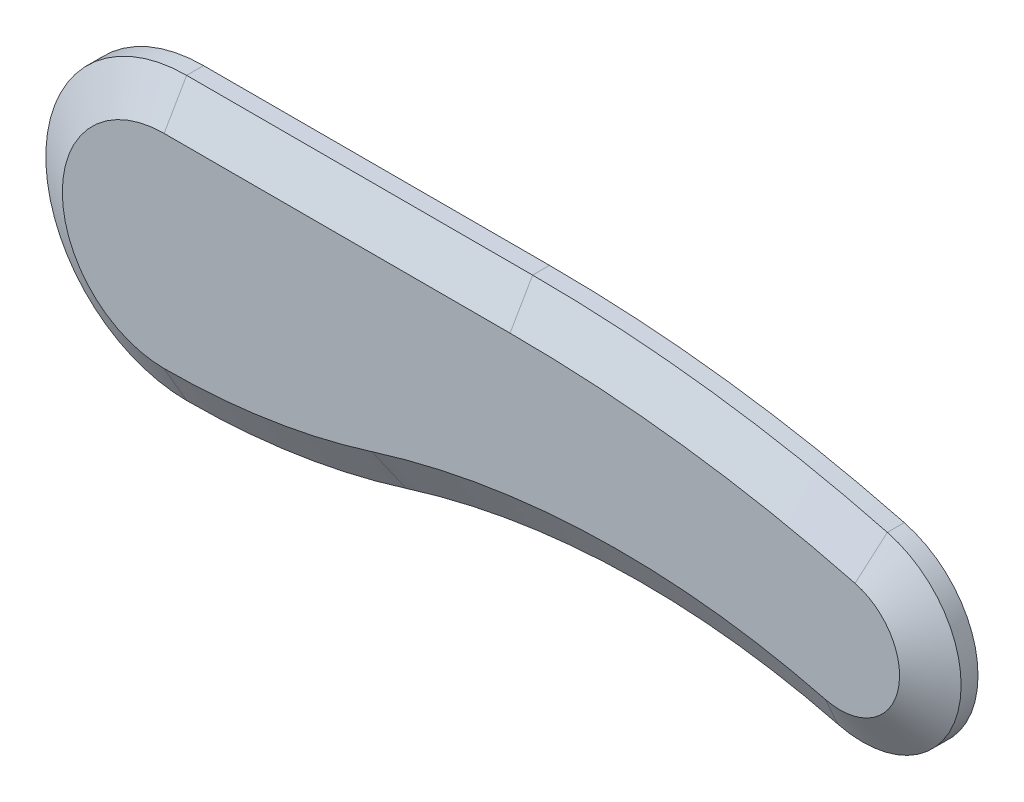
from build123d import *
from OCP.BRepFilletAPI import BRepFilletAPI_MakeChamfer

# Parameters (mm, degrees)
BOSS_EXTRUDE1_DEPTH = 7
CHAMFER1_SIZE       = 4
CHAMFER1_SIZE2      = 6.92820323
SKETCH3_R           = 8.5
CUT_EXTRUDE2_DEPTH  = 4
CUT_EXTRUDE3_DEPTH  = 3.5
SKETCH5_3_R         = 2.125
CUT_EXTRUDE4_DEPTH  = 140.826678427
CHAMFER2_SIZE       = 0.5
CHAMFER2_SIZE2      = 1.37373871
BOSS_EXTRUDE2_START = 0.5
SKETCH7_R           = 9.5
SKETCH7_R_2         = 8.5
BOSS_EXTRUDE2_DEPTH = 0.5


with BuildPart() as part:
    # Sketch1 → Boss-Extrude1 (new body)
    with BuildSketch(Plane.XY):
        with BuildLine():
            Line((61.423127431, 25), (0, 25))
            ThreePointArc((0, 25), (-25, 0), (0, -25))
            ThreePointArc((0, -25), (19.714733683, -23.496417366), (38.973425347, -19.020450397))
            ThreePointArc((38.973425347, -19.020450397), (77.172636951, -12.631763464), (115.660534054, -16.953437271))
            ThreePointArc((115.660534054, -16.953437271), (136.944496251, -4.374248141), (124.409011914, 16.935483871))
            ThreePointArc((124.409011914, 16.935483871), (93.173159181, 22.975675186), (61.423127431, 25))
        make_face()
    extrude(amount=BOSS_EXTRUDE1_DEPTH)

    # Chamfer1: one chamfer whose edges measure the first distance from different faces: ONE call of the kernel's chamfer builder (chamfer() names one face for all edges)
    chamfer1_edges_1 = [part.edges().sort_by_distance(p)[0] for p in [
        (19.714733683, -23.496417366, 7),
    ]]
    chamfer1_side_1 = [part.faces().sort_by_distance(p)[0] for p in [
        (19.714733683, -23.496417366, 3.5),
    ]]
    chamfer1_edges_2 = [part.edges().sort_by_distance(p)[0] for p in [
        (-25, 0, 7),
    ]]
    chamfer1_side_2 = [part.faces().sort_by_distance(p)[0] for p in [
        (-25, 0, 3.5),
    ]]
    chamfer1_edges_3 = [part.edges().sort_by_distance(p)[0] for p in [
        (30.711563715, 25, 7),
    ]]
    chamfer1_side_3 = [part.faces().sort_by_distance(p)[0] for p in [
        (30.711563715, 25, 3.5),
    ]]
    chamfer1_edges_4 = [part.edges().sort_by_distance(p)[0] for p in [
        (93.173159181, 22.975675186, 7),
    ]]
    chamfer1_side_4 = [part.faces().sort_by_distance(p)[0] for p in [
        (93.173159181, 22.975675186, 3.5),
    ]]
    chamfer1_edges_5 = [part.edges().sort_by_distance(p)[0] for p in [
        (136.944496251, -4.374248141, 7),
    ]]
    chamfer1_side_5 = [part.faces().sort_by_distance(p)[0] for p in [
        (136.944496251, -4.374248141, 3.5),
    ]]
    chamfer1_edges_6 = [part.edges().sort_by_distance(p)[0] for p in [
        (77.172636951, -12.631763464, 7),
    ]]
    chamfer1_side_6 = [part.faces().sort_by_distance(p)[0] for p in [
        (77.172636951, -12.631763464, 3.5),
    ]]
    chamfer1 = BRepFilletAPI_MakeChamfer(part.part.solid().wrapped)
    for e in chamfer1_edges_1:
        chamfer1.Add(CHAMFER1_SIZE, CHAMFER1_SIZE2, e.wrapped, chamfer1_side_1[0].wrapped)  # the first distance lies on this face
    for e in chamfer1_edges_2:
        chamfer1.Add(CHAMFER1_SIZE, CHAMFER1_SIZE2, e.wrapped, chamfer1_side_2[0].wrapped)  # the first distance lies on this face
    for e in chamfer1_edges_3:
        chamfer1.Add(CHAMFER1_SIZE, CHAMFER1_SIZE2, e.wrapped, chamfer1_side_3[0].wrapped)  # the first distance lies on this face
    for e in chamfer1_edges_4:
        chamfer1.Add(CHAMFER1_SIZE, CHAMFER1_SIZE2, e.wrapped, chamfer1_side_4[0].wrapped)  # the first distance lies on this face
    for e in chamfer1_edges_5:
        chamfer1.Add(CHAMFER1_SIZE, CHAMFER1_SIZE2, e.wrapped, chamfer1_side_5[0].wrapped)  # the first distance lies on this face
    for e in chamfer1_edges_6:
        chamfer1.Add(CHAMFER1_SIZE, CHAMFER1_SIZE2, e.wrapped, chamfer1_side_6[0].wrapped)  # the first distance lies on this face
    add(Compound.cast(chamfer1.Shape()), mode=Mode.REPLACE)

    # Sketch3 → Cut-Extrude2 (cut)
    with BuildSketch(Plane(origin=(0, 0, 0), x_dir=(-1, 0, 0), z_dir=(0, 0, -1))):
        Circle(SKETCH3_R)
        with Locations((-120, 0)):
            Circle(SKETCH3_R)
    extrude(amount=-CUT_EXTRUDE2_DEPTH, mode=Mode.SUBTRACT)

    # Sketch5 → Cut-Extrude3 (cut)
    with BuildSketch(Plane(origin=(0, 0, 2.5), x_dir=(-1, 0, 0), z_dir=(0, 0, -1))):
        with BuildLine():
            Line((-86.046403676, 16.921929528), (-88.139298402, 13.296929528))
            Line((-88.139298402, 13.296929528), (-86.046403676, 9.671929528))
            Line((-86.046403676, 9.671929528), (-78.548867374, 9.671929528))
            ThreePointArc((-78.548867374, 9.671929528), (-67.767719499, 13.296929528), (-78.548867374, 16.921929528))
            Line((-78.548867374, 16.921929528), (-86.046403676, 16.921929528))
        make_face()
        with BuildLine():
            Line((-62.092894726, -3.625), (-54.595358423, -3.625))
            ThreePointArc((-54.595358423, -3.625), (-43.814210548, 0), (-54.595358423, 3.625))
            Line((-54.595358423, 3.625), (-62.092894726, 3.625))
            Line((-62.092894726, 3.625), (-64.185789452, 0))
            Line((-64.185789452, 0), (-62.092894726, -3.625))
        make_face()
        with BuildLine():
            Line((-32.163058591, -14.569644586), (-24.665522288, -14.569644586))
            ThreePointArc((-24.665522288, -14.569644586), (-13.884374414, -10.944644586), (-24.665522288, -7.319644586))
            Line((-24.665522288, -7.319644586), (-32.163058591, -7.319644586))
            Line((-32.163058591, -7.319644586), (-34.255953317, -10.944644586))
            Line((-34.255953317, -10.944644586), (-32.163058591, -14.569644586))
        make_face()
    extrude(amount=-CUT_EXTRUDE3_DEPTH, mode=Mode.SUBTRACT)

    # Sketch5<3> → Cut-Extrude4 (cut, through all)
    with BuildSketch(Plane(origin=(0, 0, 2.5), x_dir=(-1, 0, 0), z_dir=(0, 0, -1))):
        with BuildLine():
            ThreePointArc((-78.548867374, 9.671929528), (-67.767719499, 13.296929528), (-78.548867374, 16.921929528))
            ThreePointArc((-78.548867374, 16.921929528), (-79.767719499, 13.296929528), (-78.548867374, 9.671929528))
        make_face()
        with BuildLine():
            ThreePointArc((-54.595358423, 3.625), (-55.814210548, 0), (-54.595358423, -3.625))
            ThreePointArc((-54.595358423, -3.625), (-43.814210548, 0), (-54.595358423, 3.625))
        make_face()
        with BuildLine():
            ThreePointArc((-24.665522288, -7.319644586), (-25.884374414, -10.944644586), (-24.665522288, -14.569644586))
            ThreePointArc((-24.665522288, -14.569644586), (-13.884374414, -10.944644586), (-24.665522288, -7.319644586))
        make_face()
        with Locations((-83.953508951, 13.296929528)):
            Circle(SKETCH5_3_R)
        with Locations((-60, 0)):
            Circle(SKETCH5_3_R)
        with Locations((-30.070163865, -10.944644586)):
            Circle(SKETCH5_3_R)
    extrude(amount=CUT_EXTRUDE4_DEPTH, mode=Mode.SUBTRACT)

    # Chamfer2: one chamfer whose edges measure the first distance from different faces: ONE call of the kernel's chamfer builder (chamfer() names one face for all edges)
    chamfer2_edges_1 = [part.edges().sort_by_distance(p)[0] for p in [
        (67.767719499, 13.296929528, 6),
    ]]
    chamfer2_side_1 = [part.faces().sort_by_distance(p)[0] for p in [
        (68.986571624, 9.671929528, 3),
    ]]
    chamfer2_edges_2 = [part.edges().sort_by_distance(p)[0] for p in [
        (13.884374414, -10.944644586, 6),
    ]]
    chamfer2_side_2 = [part.faces().sort_by_distance(p)[0] for p in [
        (15.103226539, -14.569644586, 3),
    ]]
    chamfer2_edges_3 = [part.edges().sort_by_distance(p)[0] for p in [
        (43.814210548, 0, 6),
    ]]
    chamfer2_side_3 = [part.faces().sort_by_distance(p)[0] for p in [
        (45.033062674, -3.625, 3),
    ]]
    chamfer2 = BRepFilletAPI_MakeChamfer(part.part.solid().wrapped)
    for e in chamfer2_edges_1:
        chamfer2.Add(CHAMFER2_SIZE, CHAMFER2_SIZE2, e.wrapped, chamfer2_side_1[0].wrapped)  # the first distance lies on this face
    for e in chamfer2_edges_2:
        chamfer2.Add(CHAMFER2_SIZE, CHAMFER2_SIZE2, e.wrapped, chamfer2_side_2[0].wrapped)  # the first distance lies on this face
    for e in chamfer2_edges_3:
        chamfer2.Add(CHAMFER2_SIZE, CHAMFER2_SIZE2, e.wrapped, chamfer2_side_3[0].wrapped)  # the first distance lies on this face
    add(Compound.cast(chamfer2.Shape()), mode=Mode.REPLACE)

    # Sketch7 → Boss-Extrude2 (add)
    # profile 1 of 2: a face of its own
    with BuildSketch(Plane(origin=(0, 0, 0), x_dir=(-1, 0, 0), z_dir=(0, 0, -1)).offset(BOSS_EXTRUDE2_START)):
        Circle(SKETCH7_R)
        Circle(SKETCH7_R_2, mode=Mode.SUBTRACT)
    # profile 2 of 2: a face of its own
    with BuildSketch(Plane(origin=(0, 0, 0), x_dir=(-1, 0, 0), z_dir=(0, 0, -1)).offset(BOSS_EXTRUDE2_START)):
        with Locations((-120, 0)):
            Circle(SKETCH7_R)
        with Locations((-120, 0)):
            Circle(SKETCH7_R_2, mode=Mode.SUBTRACT)
    extrude(amount=-BOSS_EXTRUDE2_DEPTH)


solid = part.part
